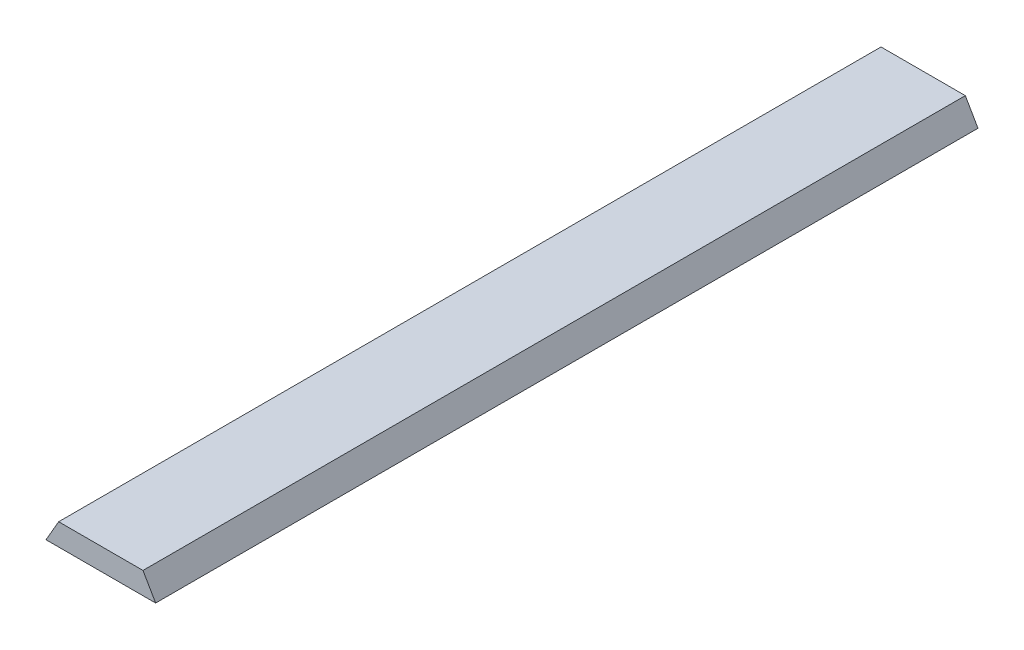
from build123d import *
from OCP.BRepFilletAPI import BRepFilletAPI_MakeChamfer

# Parameters (mm, degrees)
SKETCH1_W           = 2
SKETCH1_H           = 0.4
BOSS_EXTRUDE1_DEPTH = 15
CHAMFER1_SIZE       = 0.230940108
CHAMFER1_SIZE_2     = 0.4


with BuildPart() as part:
    # Sketch1 → Boss-Extrude1 (new body)
    with BuildSketch(Plane.XY):
        Rectangle(SKETCH1_W, SKETCH1_H)
    extrude(amount=BOSS_EXTRUDE1_DEPTH)

    # Chamfer1
    chamfer1_edges_1 = [part.edges().sort_by_distance(p)[0] for p in [
        (-1, 0.2, 7.5),
    ]]
    chamfer1_side_1 = [part.faces().sort_by_distance(p)[0] for p in [
        (-0.995381198, 0.2, 7.5),
    ]]
    chamfer1_edges_2 = [part.edges().sort_by_distance(p)[0] for p in [
        (1, 0.2, 7.5),
    ]]
    chamfer1_side_2 = [part.faces().sort_by_distance(p)[0] for p in [
        (1, 0.195381198, 7.5),
    ]]
    chamfer1 = BRepFilletAPI_MakeChamfer(part.part.solid().wrapped)
    for e in chamfer1_edges_1:
        chamfer1.Add(CHAMFER1_SIZE - 0.0001, CHAMFER1_SIZE_2 - 0.0001, e.wrapped, chamfer1_side_1[0].wrapped)
    for e in chamfer1_edges_2:
        chamfer1.Add(CHAMFER1_SIZE_2 - 0.0001, CHAMFER1_SIZE - 0.0001, e.wrapped, chamfer1_side_2[0].wrapped)
    add(Compound.cast(chamfer1.Shape()), mode=Mode.REPLACE)  # a hair under: the kernel refuses the full size


solid = part.part
